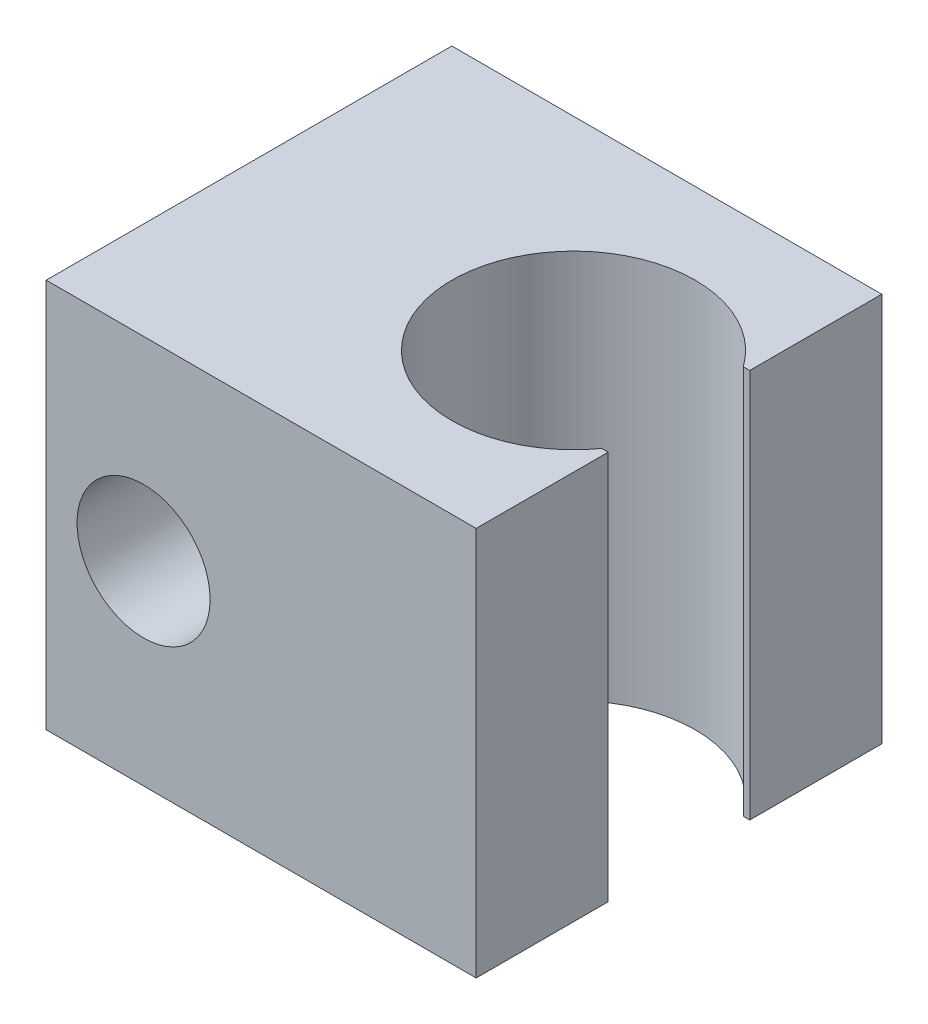
from build123d import *

# Parameters (mm, degrees)
SKETCH1_R           = 7.5
BOSS_EXTRUDE1_DEPTH = 24
CUT_EXTRUDE4_DEPTH  = 30.807717122
SKETCH7_W           = 10
SKETCH7_H           = 25
BOSS_EXTRUDE2_DEPTH = 24
SKETCH8_R           = 4.1
CUT_EXTRUDE5_DEPTH  = 48


with BuildPart() as part:
    # Sketch1 → Boss-Extrude1 (new body)
    with BuildSketch(Plane(origin=(0, 0, 0), x_dir=(1, 0, 0), z_dir=(0, 1, 0))):
        Polygon((12.5, 12.5), (0, 12.5), (-10, 12.5), (-10, -12.5), (0, -12.5), (12.5, -12.5), align=None)
        Circle(SKETCH1_R, mode=Mode.SUBTRACT)
    extrude(amount=BOSS_EXTRUDE1_DEPTH)

    # Sketch5 → Cut-Extrude4 (cut, through all)
    with BuildSketch(Plane.XZ):
        Polygon((12.5, 12.5), (6.5, 12.5), (6.5, 4.363484846), (6.1, 4.363484846), (6.1, -4.363484846), (6.5, -4.363484846), (6.5, -12.5), (12.5, -12.5), align=None)
    extrude(amount=-CUT_EXTRUDE4_DEPTH, mode=Mode.SUBTRACT)

    # Sketch7 → Boss-Extrude2 (add)
    with BuildSketch(Plane.XZ):
        with Locations((-15, 0)):
            Rectangle(SKETCH7_W, SKETCH7_H)
    extrude(amount=-BOSS_EXTRUDE2_DEPTH)

    # Sketch8 → Cut-Extrude5 (cut)
    with BuildSketch(Plane.XY.offset(12.5)):
        with Locations((-14, 12)):
            Circle(SKETCH8_R)
    extrude(amount=-CUT_EXTRUDE5_DEPTH, mode=Mode.SUBTRACT)


solid = part.part
